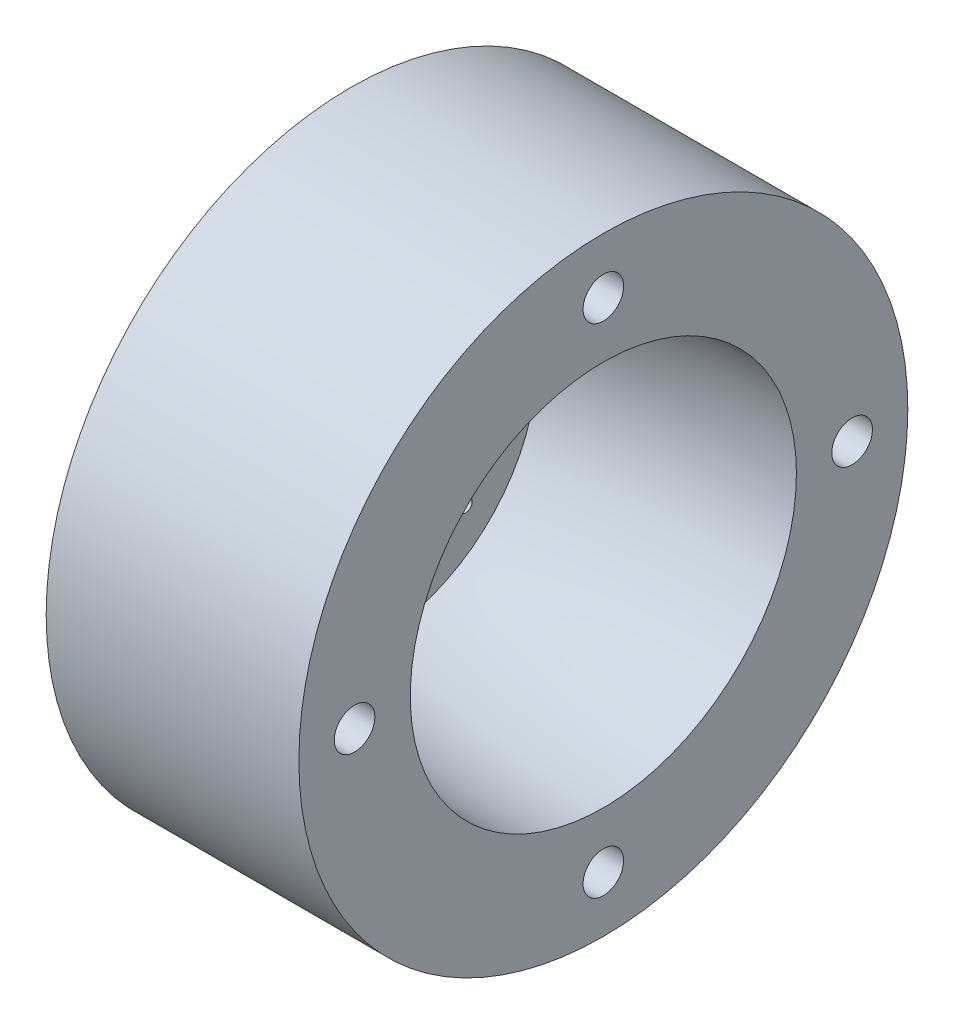
from build123d import *

# Parameters (mm, degrees)
SKETCH2_R           = 24
BOSS_EXTRUDE1_DEPTH = 19.916428128
SKETCH3_R           = 1.25
CUT_EXTRUDE1_DEPTH  = 40.353070007
SKETCH4_R           = 1.6
CUT_EXTRUDE2_DEPTH  = 40.353070007
SKETCH5_R           = 0.5
CUT_EXTRUDE3_DEPTH  = 39.148813636


# Read off the part's stored shape, not the designer's step: Roller coating 12, Roller core 12 coated
with BuildPart() as part:
    # Roller coating 12 outline → Roller coating 12 (revolve)
    with BuildSketch(Plane.YX):
        with BuildLine():
            ThreePointArc((12.7, -17.916428128), (15.217989764, 0), (12.7, 17.916428128))
            Line((12.7, 17.916428128), (8, 17.916428128))
            Line((8, 17.916428128), (8, 17.416428128))
            Line((8, 17.416428128), (12.322080058, 17.416428128))
            ThreePointArc((12.322080058, 17.416428128), (14.717989764, 0), (12.322080058, -17.416428128))
            Line((12.322080058, -17.416428128), (8, -17.416428128))
            Line((8, -17.416428128), (8, -17.916428128))
            Line((8, -17.916428128), (12.7, -17.916428128))
        make_face()
    revolve(axis=Axis((0, 0, 0), (1, 0, 0)))


with BuildPart() as body_2:
    # Roller core 12 coated outline → Roller core 12 coated (revolve)
    with BuildSketch(Plane.YX):
        with BuildLine():
            Line((1.25, 17.416428128), (1.25, -17.416428128))
            Line((1.25, -17.416428128), (12.322080058, -17.416428128))
            ThreePointArc((12.322080058, -17.416428128), (14.717989764, 0), (12.322080058, 17.416428128))
            Line((12.322080058, 17.416428128), (1.25, 17.416428128))
        make_face()
    revolve(axis=Axis((0, 0, 0), (1, 0, 0)))


with BuildPart() as part_1:
    add(part.part)

    # Combine1: union body 2
    add(body_2.part)


with BuildPart() as body_2_2:
    # Sketch2 → Boss-Extrude1 (new body)
    with BuildSketch(Plane(origin=(0, 0, 0), x_dir=(0, 0, -1), z_dir=(1, 0, 0))):
        Circle(SKETCH2_R)
    extrude(amount=-BOSS_EXTRUDE1_DEPTH)

    # Combine2: cut part
    add(part_1.part, mode=Mode.SUBTRACT)

    # Sketch3 → Cut-Extrude1 (cut, through all)
    with BuildSketch(Plane(origin=(0, 0, 0), x_dir=(0, 0, -1), z_dir=(1, 0, 0))):
        Circle(SKETCH3_R)
    extrude(amount=-CUT_EXTRUDE1_DEPTH, mode=Mode.SUBTRACT)

    # Sketch4 → Cut-Extrude2 (cut, through all)
    with BuildSketch(Plane(origin=(0, 0, 0), x_dir=(0, 0, -1), z_dir=(1, 0, 0))):
        with Locations((0, 19.608994882)):
            Circle(SKETCH4_R)
        with Locations((-19.608994882, 0)):
            Circle(SKETCH4_R)
        with Locations((0, -19.608994882)):
            Circle(SKETCH4_R)
        with Locations((19.608994882, 0)):
            Circle(SKETCH4_R)
    extrude(amount=-CUT_EXTRUDE2_DEPTH, mode=Mode.SUBTRACT)

    # Sketch5 → Cut-Extrude3 (cut, through all)
    with BuildSketch(Plane(origin=(-17.416428128, 0, 0), x_dir=(0, 0, -1), z_dir=(1, 0, 0))):
        with Locations((-7.071067812, 7.071067812)):
            Circle(SKETCH5_R)
        with Locations((0, 10)):
            Circle(SKETCH5_R)
        with Locations((-10, 0)):
            Circle(SKETCH5_R)
        with Locations((0, -10)):
            Circle(SKETCH5_R)
        with Locations((10, 0)):
            Circle(SKETCH5_R)
        with Locations((7.071067812, 7.071067812)):
            Circle(SKETCH5_R)
        with Locations((-7.071067812, -7.071067812)):
            Circle(SKETCH5_R)
        with Locations((7.071067812, -7.071067812)):
            Circle(SKETCH5_R)
    extrude(amount=-CUT_EXTRUDE3_DEPTH, mode=Mode.SUBTRACT)


solid = body_2_2.part
